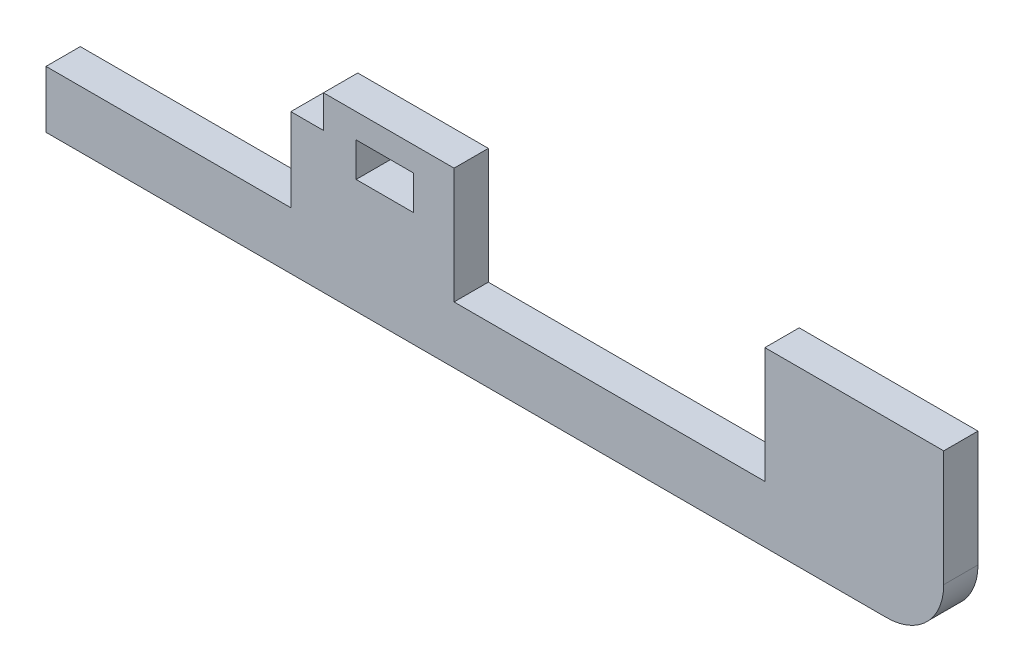
from build123d import *

# Parameters (mm, degrees)
SKETCH1_W           = 139.7
SKETCH1_H           = 26.924
BOSS_EXTRUDE1_DEPTH = 5.334
SKETCH2_W           = 38.1
SKETCH2_H           = 18.034
CUT_EXTRUDE1_DEPTH  = 104.832998003
SKETCH3_W           = 48.37176
SKETCH3_H           = 18.034
CUT_EXTRUDE3_DEPTH  = 104.832998003
SKETCH4_W           = 5.08
SKETCH4_H           = 5.08
CUT_EXTRUDE4_DEPTH  = 104.832998003
FILLET1_R           = 8.89
SKETCH5_W           = 8.89
SKETCH5_H           = 5.334
CUT_EXTRUDE5_DEPTH  = 104.832998003


with BuildPart() as part:
    # Sketch1 → Boss-Extrude1 (new body)
    with BuildSketch(Plane.XY):
        with Locations((32.120305114, 5.376704658)):
            Rectangle(SKETCH1_W, SKETCH1_H)
    extrude(amount=BOSS_EXTRUDE1_DEPTH)

    # Sketch2 → Cut-Extrude1 (cut, through all)
    with BuildSketch(Plane.XY.offset(5.334)):
        with Locations((-18.679694886, 9.821704658)):
            Rectangle(SKETCH2_W, SKETCH2_H)
    extrude(amount=-CUT_EXTRUDE1_DEPTH, mode=Mode.SUBTRACT)

    # Sketch3 → Cut-Extrude3 (cut, through all)
    with BuildSketch(Plane.XY.offset(5.334)):
        with Locations((49.956185114, 9.821704658)):
            Rectangle(SKETCH3_W, SKETCH3_H)
    extrude(amount=-CUT_EXTRUDE3_DEPTH, mode=Mode.SUBTRACT)

    # Sketch4 → Cut-Extrude4 (cut, through all)
    with BuildSketch(Plane.XY.offset(5.334)):
        with Locations((2.910305114, 16.298704658)):
            Rectangle(SKETCH4_W, SKETCH4_H)
    extrude(amount=-CUT_EXTRUDE4_DEPTH, mode=Mode.SUBTRACT)

    # Fillet1
    fillet1_edges = [part.edges().sort_by_distance(p)[0] for p in [
        (101.970305114, -8.085295342, 2.667),
    ]]
    fillet(fillet1_edges, radius=FILLET1_R)

    # Sketch5 → Cut-Extrude5 (cut, through all)
    with BuildSketch(Plane.XY.offset(5.334)):
        with Locations((14.975305114, 12.361704658)):
            Rectangle(SKETCH5_W, SKETCH5_H)
    extrude(amount=-CUT_EXTRUDE5_DEPTH, mode=Mode.SUBTRACT)


solid = part.part
